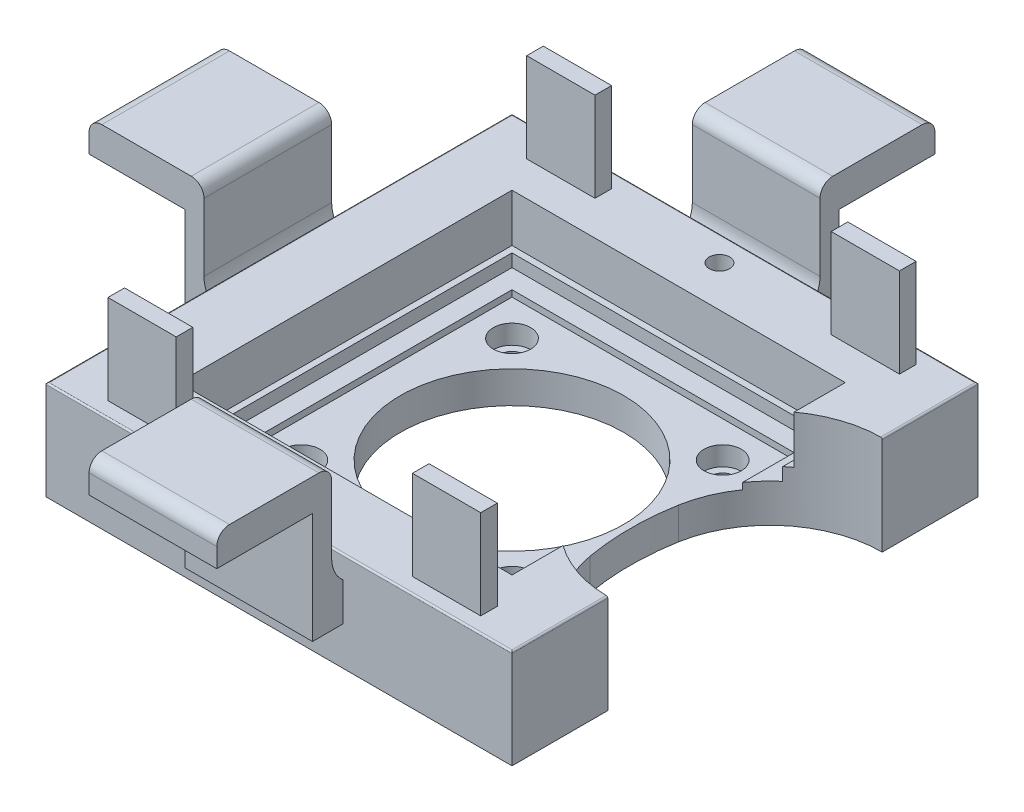
from build123d import *

# Parameters (mm, degrees)
SKETCH3_W           = 73
SKETCH3_H           = 73
BOSS_EXTRUDE3_DEPTH = 10
SKETCH3_3_W         = 50.2
SKETCH3_3_H         = 50.2
CUT_EXTRUDE2_DEPTH  = 2
SKETCH4_R           = 2.925
CUT_EXTRUDE3_DEPTH  = 4
SKETCH13_R          = 1.75
CUT_EXTRUDE6_DEPTH  = 10
SKETCH5_W           = 44.2
SKETCH5_H           = 44.2
CUT_EXTRUDE4_DEPTH  = 1
SKETCH7_W           = 73
SKETCH7_H           = 73
SKETCH7_W_2         = 52.2
SKETCH7_H_2         = 52.2
BOSS_EXTRUDE5_DEPTH = 9.5
SKETCH8_W           = 10.7
SKETCH8_H           = 2.6
BOSS_EXTRUDE6_DEPTH = 14
FILLET1_R           = 0.25
SKETCH9_R           = 17.5
CUT_EXTRUDE5_DEPTH  = 10
BOSS_EXTRUDE7_DEPTH = 10
FILLET2_R           = 5
FILLET2_R_2         = 2
SKETCH15_W          = 73
SKETCH15_H          = 73
REBAIX_DEPTH        = 2
CUT_EXTRUDE11_START = -15.5
CUT_EXTRUDE11_DEPTH = 15.5
SKETCH19_R          = 1.6
CUT_EXTRUDE12_DEPTH = 85.84323793
CHAMFER1_SIZE       = 1.5


with BuildPart() as part:
    # Sketch3 → Boss-Extrude3 (new body)
    with BuildSketch(Plane(origin=(0, 0, 0), x_dir=(1, 0, 0), z_dir=(0, 1, 0))):
        Rectangle(SKETCH3_W, SKETCH3_H)
    extrude(amount=-BOSS_EXTRUDE3_DEPTH)

    # Sketch3<3> → Cut-Extrude2 (cut)
    with BuildSketch(Plane(origin=(0, 0, 0), x_dir=(1, 0, 0), z_dir=(0, 1, 0))):
        Rectangle(SKETCH3_3_W, SKETCH3_3_H)
    extrude(amount=-CUT_EXTRUDE2_DEPTH, mode=Mode.SUBTRACT)

    # Sketch4 → Cut-Extrude3 (cut)
    with BuildSketch(Plane(origin=(0, -2, 0), x_dir=(1, 0, 0), z_dir=(0, 1, 0))):
        with Locations(Location((-16.5, 16.5, 0), (0, 0, 270))):
            Circle(SKETCH4_R)
        with Locations(Location((16.5, 16.5, 0), (0, 0, 270))):
            Circle(SKETCH4_R)
        with Locations(Location((-16.5, -16.5, 0), (0, 0, 270))):
            Circle(SKETCH4_R)
        with Locations(Location((16.5, -16.5, 0), (0, 0, 270))):
            Circle(SKETCH4_R)
    extrude(amount=-CUT_EXTRUDE3_DEPTH, mode=Mode.SUBTRACT)

    # Sketch13 → Cut-Extrude6 (cut)
    with BuildSketch(Plane(origin=(0, -6, 0), x_dir=(1, 0, 0), z_dir=(0, 1, 0))):
        with Locations(Location((16.5, 16.5, 0), (0, 0, 270))):
            Circle(SKETCH13_R)
        with Locations(Location((16.5, -16.5, 0), (0, 0, 270))):
            Circle(SKETCH13_R)
        with Locations(Location((-16.5, -16.5, 0), (0, 0, 270))):
            Circle(SKETCH13_R)
        with Locations(Location((-16.5, 16.5, 0), (0, 0, 270))):
            Circle(SKETCH13_R)
    extrude(amount=-CUT_EXTRUDE6_DEPTH, mode=Mode.SUBTRACT)

    # Sketch5 → Cut-Extrude4 (cut)
    with BuildSketch(Plane(origin=(0, -2, 0), x_dir=(1, 0, 0), z_dir=(0, 1, 0))):
        Rectangle(SKETCH5_W, SKETCH5_H)
    extrude(amount=-CUT_EXTRUDE4_DEPTH, mode=Mode.SUBTRACT)

    # Sketch7 → Boss-Extrude5 (add)
    with BuildSketch(Plane(origin=(0, -2, 0), x_dir=(1, 0, 0), z_dir=(0, 1, 0))):
        Rectangle(SKETCH7_W, SKETCH7_H)
        Rectangle(SKETCH7_W_2, SKETCH7_H_2, mode=Mode.SUBTRACT)
    extrude(amount=BOSS_EXTRUDE5_DEPTH)

    # Sketch8 → Boss-Extrude6 (add)
    with BuildSketch(Plane(origin=(0, 7.5, 0), x_dir=(1, 0, 0), z_dir=(0, 1, 0))):
        with Locations((-23.85, 32.8)):
            Rectangle(SKETCH8_W, SKETCH8_H)
        with Locations((-23.85, -32.8)):
            Rectangle(SKETCH8_W, SKETCH8_H)
        with Locations((23.85, 32.8)):
            Rectangle(SKETCH8_W, SKETCH8_H)
        with Locations((23.85, -32.8)):
            Rectangle(SKETCH8_W, SKETCH8_H)
    extrude(amount=BOSS_EXTRUDE6_DEPTH)

    # Fillet1
    fillet1_edges = [part.edges().sort_by_distance(p)[0] for p in [
        (-36.5, 7.5, 0),
        (0, 7.5, 36.5),
        (36.5, 7.5, 0),
        (0, 7.5, -36.5),
    ]]
    fillet(fillet1_edges, radius=FILLET1_R)

    # Sketch9 → Cut-Extrude5 (cut)
    with BuildSketch(Plane(origin=(0, -3, 0), x_dir=(1, 0, 0), z_dir=(0, 1, 0))):
        with Locations(Location((0, 0, 0), (0, 0, 270))):
            Circle(SKETCH9_R)
    extrude(amount=-CUT_EXTRUDE5_DEPTH, mode=Mode.SUBTRACT)

    # Sketch10 → Boss-Extrude7 (add, symmetric)
    with BuildSketch(Plane(origin=(0, 0, 0), x_dir=(0, 0, -1), z_dir=(1, 0, 0))):
        Polygon((-36.5, -2), (-36.5, 4), (-38.25, 4), (-38.25, 20.375), (-56.25, 20.375), (-56.25, 15.375), (-41.25, 15.375), (-41.25, -2), align=None)
    extrude(amount=BOSS_EXTRUDE7_DEPTH, both=True)

    # Fillet2
    # the kernel refuses this fillet: 5, 2 mm, written as the material it adds along each edge
    with BuildSketch(Plane(origin=(-10, 4, 38.25), x_dir=(0, 0, -1), z_dir=(1, 0, 0))) as fillet2_piece_1:
        with BuildLine():
            CenterArc((5, 3.799671038), FILLET2_R, 180, 49.458398126)
            Line((0, 3.799671038), (0, 0))
            Line((0, 0), (1.75, 0))
        make_face()
    extrude(amount=20)
    # the kernel refuses this fillet: 5, 2 mm, written as the material it takes off along each edge
    with BuildSketch(Plane(origin=(-15, 20.375, 56.25), x_dir=(0, 0, -1), z_dir=(1, 0, 0)), Plane(origin=(-15, 20.375, 38.25), x_dir=(0, -1, 0), z_dir=(1, 0, 0))) as fillet2_2_piece_1:
        with BuildLine():
            CenterArc((FILLET2_R_2, -FILLET2_R_2), FILLET2_R_2, 90, 90)
            Line((0, -FILLET2_R_2), (0, 0))
            Line((0, 0), (FILLET2_R_2, 0))
        make_face()
    extrude(amount=30, mode=Mode.SUBTRACT)

    # CirPattern1: read off the stored shape, not the designer's step
    # CirPattern1: loft between two sections, ruled curve by curve
    cirpattern1_from = [
        Edge.make_three_point_arc((-38.25, 7.799671038, -10), (-37.791475531, 5.708020972, -10), (-36.5, 4, -10)),
        Edge.make_three_point_arc((-40.25, 20.375, -10), (-38.835786438, 19.789213562, -10), (-38.25, 18.375, -10)),
        Edge.make_three_point_arc((-56.25, 18.375, -10), (-55.664213562, 19.789213562, -10), (-54.25, 20.375, -10)),
        Edge.make_line((-41.25, -2, -10), (-36.5, -2, -10)),
        Edge.make_line((-40.25, 20.375, -10), (-54.25, 20.375, -10)),
        Edge.make_line((-56.25, 15.375, -10), (-41.25, 15.375, -10)),
        Edge.make_line((-41.25, 15.375, -10), (-41.25, -2, -10)),
        Edge.make_line((-38.25, 7.799671038, -10), (-38.25, 18.375, -10)),
        Edge.make_line((-56.25, 18.375, -10), (-56.25, 15.375, -10)),
        Edge.make_line((-36.5, -2, -10), (-36.5, 4, -10)),
    ]
    cirpattern1_to = [
        Edge.make_three_point_arc((-38.25, 7.799671038, 10), (-37.791475531, 5.708020972, 10), (-36.5, 4, 10)),
        Edge.make_three_point_arc((-40.25, 20.375, 10), (-38.835786438, 19.789213562, 10), (-38.25, 18.375, 10)),
        Edge.make_three_point_arc((-56.25, 18.375, 10), (-55.664213562, 19.789213562, 10), (-54.25, 20.375, 10)),
        Edge.make_line((-41.25, -2, 10), (-36.5, -2, 10)),
        Edge.make_line((-40.25, 20.375, 10), (-54.25, 20.375, 10)),
        Edge.make_line((-56.25, 15.375, 10), (-41.25, 15.375, 10)),
        Edge.make_line((-41.25, 15.375, 10), (-41.25, -2, 10)),
        Edge.make_line((-38.25, 7.799671038, 10), (-38.25, 18.375, 10)),
        Edge.make_line((-56.25, 18.375, 10), (-56.25, 15.375, 10)),
        Edge.make_line((-36.5, -2, 10), (-36.5, 4, 10)),
    ]
    cirpattern1 = Solid(Shell([*[Face.make_surface_from_curves(cirpattern1_from[k], cirpattern1_to[k]) for k in range(10)], Face(Wire(cirpattern1_from)), Face(Wire(cirpattern1_to))]))
    add(cirpattern1)

    # CirPattern1 2: loft between two sections, ruled curve by curve
    cirpattern1_2_from = [
        Edge.make_three_point_arc((10, 7.799671038, -38.25), (10, 5.708020972, -37.791475531), (10, 4, -36.5)),
        Edge.make_three_point_arc((10, 20.375, -40.25), (10, 19.789213562, -38.835786438), (10, 18.375, -38.25)),
        Edge.make_three_point_arc((10, 18.375, -56.25), (10, 19.789213562, -55.664213562), (10, 20.375, -54.25)),
        Edge.make_line((10, -2, -41.25), (10, -2, -36.5)),
        Edge.make_line((10, 20.375, -40.25), (10, 20.375, -54.25)),
        Edge.make_line((10, 15.375, -56.25), (10, 15.375, -41.25)),
        Edge.make_line((10, 15.375, -41.25), (10, -2, -41.25)),
        Edge.make_line((10, 7.799671038, -38.25), (10, 18.375, -38.25)),
        Edge.make_line((10, 18.375, -56.25), (10, 15.375, -56.25)),
        Edge.make_line((10, -2, -36.5), (10, 4, -36.5)),
    ]
    cirpattern1_2_to = [
        Edge.make_three_point_arc((-10, 7.799671038, -38.25), (-10, 5.708020972, -37.791475531), (-10, 4, -36.5)),
        Edge.make_three_point_arc((-10, 20.375, -40.25), (-10, 19.789213562, -38.835786438), (-10, 18.375, -38.25)),
        Edge.make_three_point_arc((-10, 18.375, -56.25), (-10, 19.789213562, -55.664213562), (-10, 20.375, -54.25)),
        Edge.make_line((-10, -2, -41.25), (-10, -2, -36.5)),
        Edge.make_line((-10, 20.375, -40.25), (-10, 20.375, -54.25)),
        Edge.make_line((-10, 15.375, -56.25), (-10, 15.375, -41.25)),
        Edge.make_line((-10, 15.375, -41.25), (-10, -2, -41.25)),
        Edge.make_line((-10, 7.799671038, -38.25), (-10, 18.375, -38.25)),
        Edge.make_line((-10, 18.375, -56.25), (-10, 15.375, -56.25)),
        Edge.make_line((-10, -2, -36.5), (-10, 4, -36.5)),
    ]
    cirpattern1_2 = Solid(Shell([*[Face.make_surface_from_curves(cirpattern1_2_from[k], cirpattern1_2_to[k]) for k in range(10)], Face(Wire(cirpattern1_2_from)), Face(Wire(cirpattern1_2_to))]))
    add(cirpattern1_2)

    # Sketch15 → rebaix (cut)
    with BuildSketch(Plane.XZ.offset(10)):
        Rectangle(SKETCH15_W, SKETCH15_H)
    extrude(amount=-REBAIX_DEPTH, mode=Mode.SUBTRACT)

    # Cut-Extrude11: read off the stored shape, not the designer's step
    # Cut-Extrude11 outline → Cut-Extrude11 (cut)
    with BuildSketch(Plane(origin=(0, 7.5, 0), x_dir=(1, 0, 0), z_dir=(0, 1, 0)).offset(CUT_EXTRUDE11_START)):
        with BuildLine():
            ThreePointArc((19.158528942, 6.947258634), (18.550604255, 0), (19.158528942, -6.947258634))
            ThreePointArc((19.158528942, -6.947258634), (25.181319297, -17.378426685), (36.500000379, -21.497981165))
            Line((36.500000379, -21.497981165), (36.500002527, 21.497981165))
            ThreePointArc((36.500002527, 21.497981165), (25.181320119, 17.378427376), (19.158528942, 6.947258634))
        make_face()
    extrude(amount=CUT_EXTRUDE11_DEPTH, mode=Mode.SUBTRACT)

    # Sketch19 → Cut-Extrude12 (cut, through all)
    with BuildSketch(Plane(origin=(0, -8, 0), x_dir=(-1, 0, 0), z_dir=(0, -1, 0))):
        with Locations(Location((0, -32.5, 0), (0, 0, 90))):
            Circle(SKETCH19_R)
        with Locations(Location((0, 32.5, 0), (0, 0, 90))):
            Circle(SKETCH19_R)
    extrude(amount=-CUT_EXTRUDE12_DEPTH, mode=Mode.SUBTRACT)

    # Chamfer1
    chamfer1_edges = [part.edges().sort_by_distance(p)[0] for p in [
        (16.5, -8, 14.75),
        (-16.5, -8, -18.25),
        (-16.5, -8, 14.75),
        (16.5, -8, -18.25),
    ]]
    chamfer(chamfer1_edges, length=CHAMFER1_SIZE)


solid = part.part
